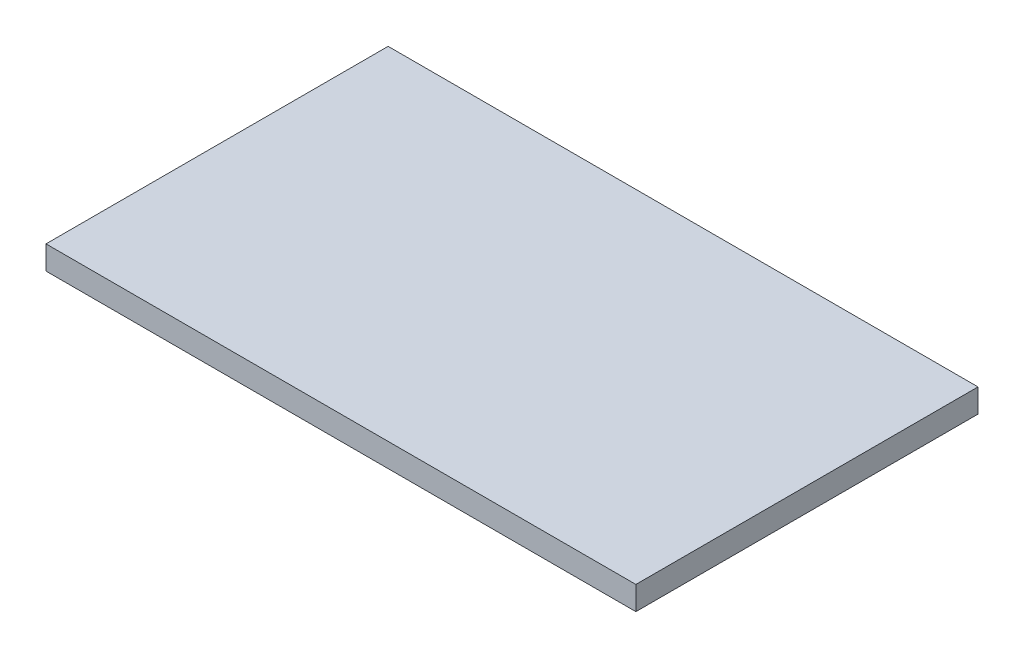
from build123d import *

# Parameters (mm, degrees)
SKETCH1_W           = 25
SKETCH1_H           = 14.5
BOSS_EXTRUDE1_DEPTH = 1


with BuildPart() as part:
    # Sketch1 → Boss-Extrude1 (new body)
    with BuildSketch(Plane(origin=(0, 0, 0), x_dir=(1, 0, 0), z_dir=(0, 1, 0))):
        with Locations((12.5, 7.25)):
            Rectangle(SKETCH1_W, SKETCH1_H)
    extrude(amount=BOSS_EXTRUDE1_DEPTH)


solid = part.part
